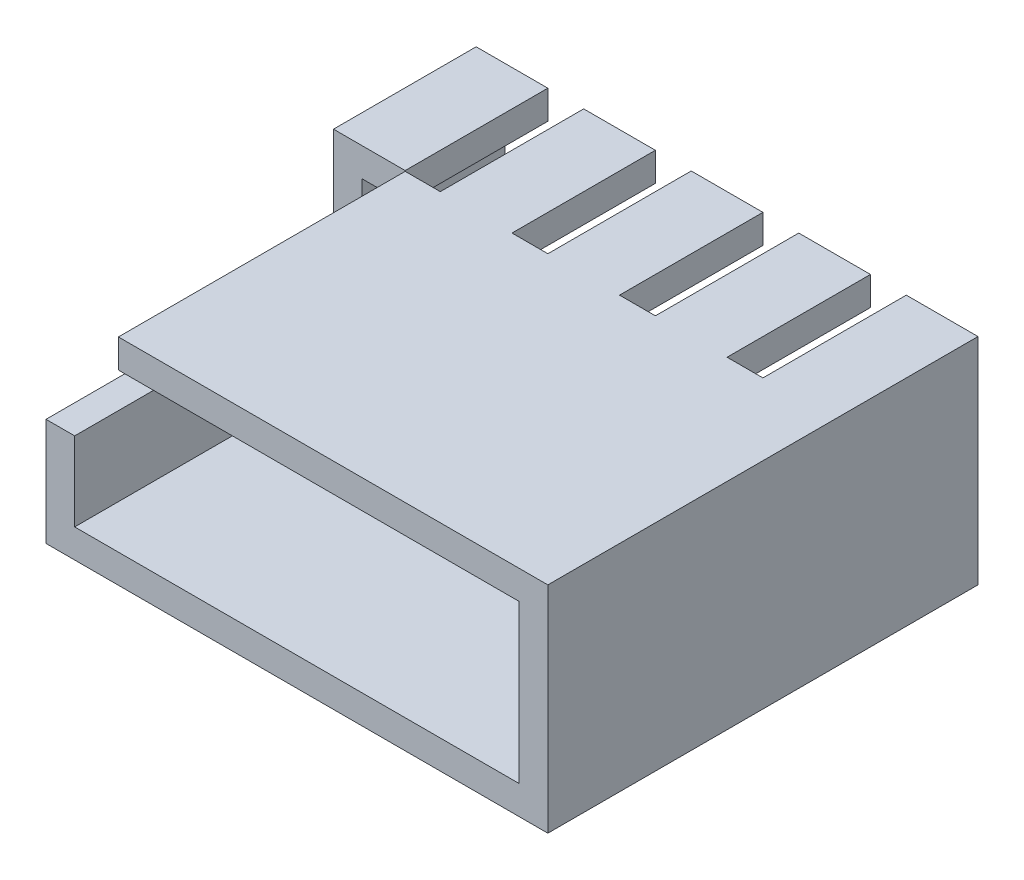
from build123d import *

# Parameters (mm, degrees)
SKETCH1_W           = 88.9
SKETCH1_H           = 76.2
BOSS_EXTRUDE1_DEPTH = 38.1
SHELL1_T            = -5.08
CUT_EXTRUDE3_START  = -19.05
SKETCH4_W           = 12.827
SKETCH4_H           = 50.927
CUT_EXTRUDE3_DEPTH  = 105.081068378
SKETCH5_W           = 6.35
SKETCH5_H           = 25.4
CUT_EXTRUDE4_DEPTH  = 124.131068378


with BuildPart() as part:
    # Sketch1 → Boss-Extrude1 (new body)
    with BuildSketch(Plane(origin=(0, 0, 0), x_dir=(1, 0, 0), z_dir=(0, 1, 0))):
        with Locations((44.45, 38.1)):
            Rectangle(SKETCH1_W, SKETCH1_H)
    extrude(amount=BOSS_EXTRUDE1_DEPTH)

    # Shell1
    shell1_openings = [part.faces().sort_by_distance(p)[0] for p in [
        (44.45, 19.05, -76.2),
        (44.45, 19.05, 0),
    ]]
    offset(amount=SHELL1_T, openings=shell1_openings, kind=Kind.INTERSECTION)

    # Sketch4 → Cut-Extrude3 (cut, through all)
    with BuildSketch(Plane.XZ.offset(CUT_EXTRUDE3_START)):
        with Locations((6.4135, -25.4635)):
            Rectangle(SKETCH4_W, SKETCH4_H)
    extrude(amount=-CUT_EXTRUDE3_DEPTH, mode=Mode.SUBTRACT)

    # Sketch5 → Cut-Extrude4 (cut, through all)
    with BuildSketch(Plane(origin=(0, 38.1, 0), x_dir=(1, 0, 0), z_dir=(0, 1, 0))):
        with Locations((15.875, 63.5)):
            Rectangle(SKETCH5_W, SKETCH5_H)
        with Locations((34.925, 63.5)):
            Rectangle(SKETCH5_W, SKETCH5_H)
        with Locations((53.975, 63.5)):
            Rectangle(SKETCH5_W, SKETCH5_H)
        with Locations((73.025, 63.5)):
            Rectangle(SKETCH5_W, SKETCH5_H)
    extrude(amount=-CUT_EXTRUDE4_DEPTH, mode=Mode.SUBTRACT)


solid = part.part
